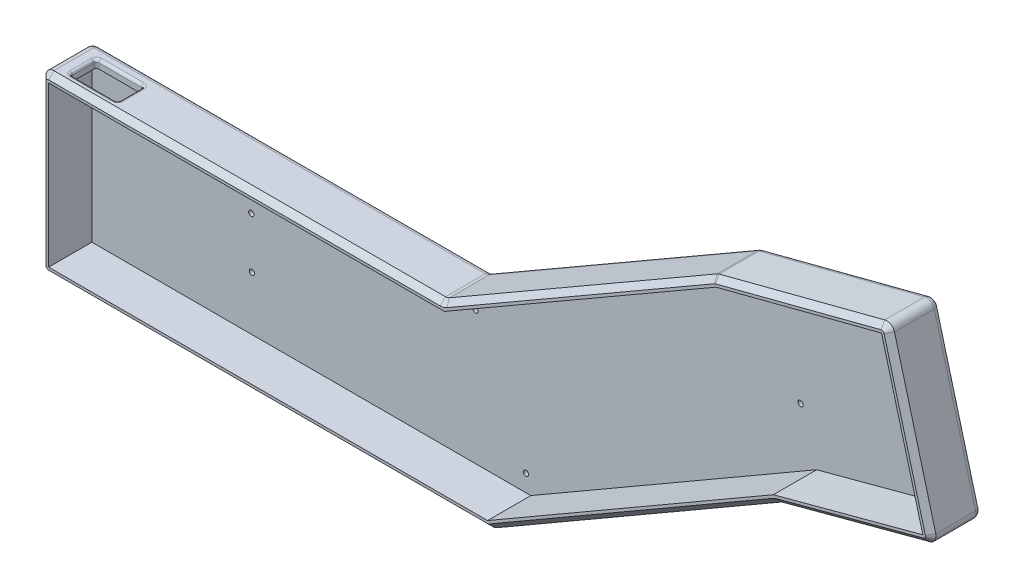
from build123d import *

# Parameters (mm, degrees)
BOSS_EXTRU_1_DEPTH      = 19
CONG_1_R                = 3
ESQUISSE1_R             = 1
BOSS_EXTRU_2_DEPTH      = 2.7
ESQUISSE2_R             = 2
ESQUISSE2_R_2           = 1
ENL_V_MAT_EXTRU_1_DEPTH = 1
CHANFREIN1_SIZE         = 2
CONG_2_R                = 2
ENL_V_MAT_EXTRU_2_DEPTH = 10
CONG_3_R                = 1


with BuildPart() as part:
    # Model → Boss.-Extru.1 (new body)
    with BuildSketch(Plane.XY):
        Polygon((76.096991945, 69.210096437), (-25.928539703, 10.301582208), (-177.373873722, 10.291172324), (-177.373873722, -50.687645053), (-177.373873722, -55.858487698), (-8.057042666, -55.858487698), (100.081941761, 6.672683012), (158.934643692, 22.435471273), (141.828136311, 86.310332452), align=None)
        Polygon((-174.373873722, 7.291378528), (-25.124548608, 7.301637465), (77.245358051, 66.408990356), (139.700811798, 82.657041562), (155.26069475, 24.557200291), (98.923133978, 9.468053786), (-8.861972593, -52.858487698), (-174.373873722, -52.858487698), (-174.373873722, -50.687645053), align=None, mode=Mode.SUBTRACT)
    extrude(amount=BOSS_EXTRU_1_DEPTH)

    # Congé1
    cong_1_edges = [part.edges().sort_by_distance(p)[0] for p in [
        (-25.928539703, 10.301582208, 9.5),
        (76.096991945, 69.210096437, 9.5),
        (141.828136311, 86.310332452, 9.5),
        (158.934643692, 22.435471273, 9.5),
        (100.081941761, 6.672683012, 9.5),
        (-8.057042666, -55.858487698, 9.5),
        (-177.373873722, -55.858487698, 9.5),
        (-177.373873722, 10.291172324, 9.5),
    ]]
    fillet(cong_1_edges, radius=CONG_1_R)

    # Esquisse1 → Boss.-Extru.2 (add)
    with BuildSketch(Plane.XY):
        Polygon((-25.124548608, 7.301637465), (-174.373873722, 7.291378528), (-174.373873722, -50.687645053), (-174.373873722, -52.858487698), (-8.861972593, -52.858487698), (98.923133978, 9.468053786), (155.26069475, 24.557200291), (139.700811798, 82.657041562), (77.245358051, 66.408990356), align=None)
        with Locations((-114.259444544, -13.418125698)):
            Circle(ESQUISSE1_R, mode=Mode.SUBTRACT)
        with Locations((-114.030844544, -32.493525698)):
            Circle(ESQUISSE1_R, mode=Mode.SUBTRACT)
        with Locations((-29.702844544, -2.648525698)):
            Circle(ESQUISSE1_R, mode=Mode.SUBTRACT)
        with Locations((-10.652844544, -46.438125698)):
            Circle(ESQUISSE1_R, mode=Mode.SUBTRACT)
        with Locations((80.685555456, 58.489274302)):
            Circle(ESQUISSE1_R, mode=Mode.SUBTRACT)
        with Locations((92.877555456, 28.085474302)):
            Circle(ESQUISSE1_R, mode=Mode.SUBTRACT)
    extrude(amount=BOSS_EXTRU_2_DEPTH)

    # Esquisse2 → Enlèv. mat.-Extru.1 (cut)
    # profile 1 of 6: a face of its own
    with BuildSketch(Plane(origin=(0, 0, 0), x_dir=(-1, 0, 0), z_dir=(0, 0, -1))):
        with Locations((-80.685555456, 58.489274302)):
            Circle(ESQUISSE2_R)
        with Locations((-80.685555456, 58.489274302)):
            Circle(ESQUISSE2_R_2, mode=Mode.SUBTRACT)
    # profile 2 of 6: a face of its own
    with BuildSketch(Plane(origin=(0, 0, 0), x_dir=(-1, 0, 0), z_dir=(0, 0, -1))):
        with Locations((-92.877555456, 28.085474302)):
            Circle(ESQUISSE2_R)
        with Locations((-92.877555456, 28.085474302)):
            Circle(ESQUISSE2_R_2, mode=Mode.SUBTRACT)
    # profile 3 of 6: a face of its own
    with BuildSketch(Plane(origin=(0, 0, 0), x_dir=(-1, 0, 0), z_dir=(0, 0, -1))):
        with Locations((29.702844544, -2.648525698)):
            Circle(ESQUISSE2_R)
        with Locations((29.702844544, -2.648525698)):
            Circle(ESQUISSE2_R_2, mode=Mode.SUBTRACT)
    # profile 4 of 6: a face of its own
    with BuildSketch(Plane(origin=(0, 0, 0), x_dir=(-1, 0, 0), z_dir=(0, 0, -1))):
        with Locations((10.652844544, -46.438125698)):
            Circle(ESQUISSE2_R)
        with Locations((10.652844544, -46.438125698)):
            Circle(ESQUISSE2_R_2, mode=Mode.SUBTRACT)
    # profile 5 of 6: a face of its own
    with BuildSketch(Plane(origin=(0, 0, 0), x_dir=(-1, 0, 0), z_dir=(0, 0, -1))):
        with Locations((114.259444544, -13.418125698)):
            Circle(ESQUISSE2_R)
        with Locations((114.259444544, -13.418125698)):
            Circle(ESQUISSE2_R_2, mode=Mode.SUBTRACT)
    # profile 6 of 6: a face of its own
    with BuildSketch(Plane(origin=(0, 0, 0), x_dir=(-1, 0, 0), z_dir=(0, 0, -1))):
        with Locations((114.030844544, -32.493525698)):
            Circle(ESQUISSE2_R)
        with Locations((114.030844544, -32.493525698)):
            Circle(ESQUISSE2_R_2, mode=Mode.SUBTRACT)
    extrude(amount=-ENL_V_MAT_EXTRU_1_DEPTH, mode=Mode.SUBTRACT)

    # Chanfrein1
    chanfrein1_edges = [part.edges().sort_by_distance(p)[0] for p in [
        (141.210432656, 85.249539366, 19),
        (150.378629519, 54.383209367, 19),
        (157.858595311, 23.056896097, 19),
        (128.250722147, 14.217256264, 19),
        (100.091914608, 6.648625697, 19),
        (46.189388475, -24.49058773, 19),
        (-8.084540154, -55.756003669, 19),
        (-91.617923158, -55.858487698, 19),
        (-176.495194066, -54.979808041, 19),
        (-177.373873722, -22.783554585, 19),
        (-176.495266971, 9.412625963, 19),
        (-100.55320226, 10.296452739, 19),
        (-25.955930978, 10.403787708, 19),
        (25.256413626, 39.855258654, 19),
        (76.107372343, 69.184776466, 19),
        (107.717763914, 77.436374389, 19),
    ]]
    chamfer(chanfrein1_edges, length=CHANFREIN1_SIZE)

    # Congé2
    cong_2_edges = [part.edges().sort_by_distance(p)[0] for p in [
        (100.091914608, 6.648625697, 0),
        (46.189388475, -24.49058773, 0),
        (-8.084540154, -55.756003669, 0),
        (-91.617923158, -55.858487698, 0),
        (-176.495194066, -54.979808041, 0),
        (-177.373873722, -22.783554585, 0),
        (-176.495266971, 9.412625963, 0),
        (-100.55320226, 10.296452739, 0),
        (-25.955930978, 10.403787708, 0),
        (25.256413626, 39.855258654, 0),
        (76.107372343, 69.184776466, 0),
        (107.717763914, 77.436374389, 0),
        (141.210432656, 85.249539366, 0),
        (150.378629519, 54.383209367, 0),
        (157.858595311, 23.056896097, 0),
        (128.250722147, 14.217256264, 0),
    ]]
    fillet(cong_2_edges, radius=CONG_2_R)

    # Esquisse3 → Enlèv. mat.-Extru.2 (cut)
    with BuildSketch(Plane(origin=(-0.000708221, 10.303364407, 0), x_dir=(0.9999999976376189, 6.873690724146162e-05, 0), z_dir=(-6.873690724146162e-05, 0.9999999976376189, 0))):
        with BuildLine():
            Line((-169.373372124, -5), (-153.373372124, -5))
            ThreePointArc((-153.373372124, -5), (-152.666265342, -5.292893219), (-152.373372124, -6))
            Line((-152.373372124, -6), (-152.373372124, -14))
            ThreePointArc((-152.373372124, -14), (-152.666265342, -14.707106781), (-153.373372124, -15))
            Line((-153.373372124, -15), (-169.373372124, -15))
            ThreePointArc((-169.373372124, -15), (-170.080478905, -14.707106781), (-170.373372124, -14))
            Line((-170.373372124, -14), (-170.373372124, -6))
            ThreePointArc((-170.373372124, -6), (-170.080478905, -5.292893219), (-169.373372124, -5))
        make_face()
    extrude(amount=-ENL_V_MAT_EXTRU_2_DEPTH, mode=Mode.SUBTRACT)

    # Congé3
    cong_3_edges = [part.edges().sort_by_distance(p)[0] for p in [
        (-152.666973203, 10.2928706, 5.292893219),
        (-152.374079985, 10.292890732, 10),
        (-152.666973203, 10.2928706, 14.707106781),
        (-161.374079964, 10.2922721, 15),
        (-170.081186724, 10.291673601, 14.707106781),
        (-170.374079942, 10.291653468, 10),
        (-170.081186724, 10.291673601, 5.292893219),
        (-161.374079964, 10.2922721, 5),
    ]]
    fillet(cong_3_edges, radius=CONG_3_R)


solid = part.part
